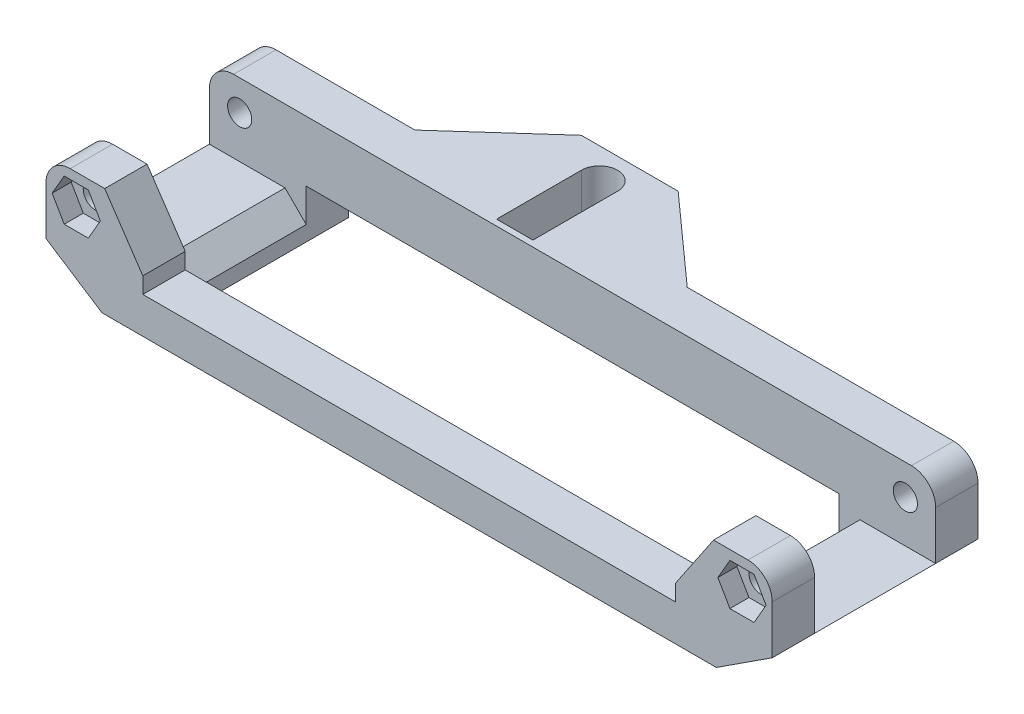
from build123d import *
from OCP.BRepFilletAPI import BRepFilletAPI_MakeChamfer

# Parameters (mm, degrees)
BOSS_EXTRUDE1_DEPTH                             = 10
FILLET4_R                                       = 4
SKETCH8_W                                       = 16
SKETCH8_H                                       = 7
BOSS_EXTRUDE3_DEPTH                             = 2
SKETCH9_W                                       = 16
SKETCH9_H                                       = 34
BOSS_EXTRUDE4_DEPTH                             = 6
BOSS_EXTRUDE5_DEPTH                             = 10
CUT_EXTRUDE3_DEPTH                              = 10
CHAMFER1_SIZE                                   = 6
CHAMFER1_SIZE_2                                 = 9.239189783
SKETCH13_W                                      = 7
SKETCH13_H                                      = 6
BOSS_EXTRUDE6_DEPTH                             = 88
CHAMFER2_SIZE                                   = 3.5
CSK_FOR_M4_FLAT_HEAD_MACHINE_SCREW1_D           = 4
CSK_FOR_M4_FLAT_HEAD_MACHINE_SCREW1_DEPTH       = 53.798278762
CSK_FOR_M4_FLAT_HEAD_MACHINE_SCREW1_CSINK_D     = 7.6
CSK_FOR_M4_FLAT_HEAD_MACHINE_SCREW1_CSINK_ANGLE = 90
CSK_FOR_M4_FLAT_HEAD_MACHINE_SCREW1_TIP         = 1.201721238
FILLET5_R                                       = 4
SKETCH17_W                                      = 6
SKETCH17_H                                      = 1
BOSS_EXTRUDE7_DEPTH                             = 10
CUT_EXTRUDE4_DEPTH                              = 3.15
CHAMFER3_SIZE                                   = 6.3
CHAMFER3_SIZE2                                  = 9.340134102


# Some blends are built 0.0001 mm under size
with BuildPart() as part:
    # Sketch1 → Boss-Extrude1 (new body)
    with BuildSketch(Plane(origin=(0, 0, 0), x_dir=(1, 0, 0), z_dir=(0, 1, 0))):
        Polygon((0, 17), (-60, 17), (-60, 10), (-43.720595315, 10), (-36.720595315, 10), (-28, 10), (-20, 10), (0, 10), align=None)
        Polygon((60, 17), (0, 17), (0, 10), (20, 10), (28, 10), (36.720595315, 10), (43.720595315, 10), (60, 10), align=None)
        Polygon((60, -10), (51, -10), (44, -10), (44, -17), (60, -17), align=None)
        Polygon((-44, -10), (-51, -10), (-60, -10), (-60, -17), (-44, -17), align=None)
    extrude(amount=BOSS_EXTRUDE1_DEPTH)

    # Fillet4
    fillet4_edges = [part.edges().sort_by_distance(p)[0] for p in [
        (60, 10, -13.5),
        (-60, 10, -13.5),
    ]]
    fillet(fillet4_edges, radius=FILLET4_R)

    # Sketch8 → Boss-Extrude3 (add)
    with BuildSketch(Plane.XZ):
        with Locations((-52, 13.5)):
            Rectangle(SKETCH8_W, SKETCH8_H)
        with Locations((52, 13.5)):
            Rectangle(SKETCH8_W, SKETCH8_H)
        with Locations((52, -13.5)):
            Rectangle(SKETCH8_W, SKETCH8_H)
        with Locations((-52, -13.5)):
            Rectangle(SKETCH8_W, SKETCH8_H)
    extrude(amount=BOSS_EXTRUDE3_DEPTH)

    # Sketch9 → Boss-Extrude4 (add)
    with BuildSketch(Plane.XZ.offset(2)):
        with Locations((-52, 0)):
            Rectangle(SKETCH9_W, SKETCH9_H)
        with Locations((52, 0)):
            Rectangle(SKETCH9_W, SKETCH9_H)
    extrude(amount=BOSS_EXTRUDE4_DEPTH)

    # Sketch10 → Boss-Extrude5 (add)
    with BuildSketch(Plane(origin=(0, 10, 0), x_dir=(1, 0, 0), z_dir=(0, 1, 0))):
        Polygon((-33.045425071, 17), (-18.545425071, 30), (-2.545425071, 30), (11.954574929, 17), align=None)
    extrude(amount=-BOSS_EXTRUDE5_DEPTH)

    # Sketch11 → Cut-Extrude3 (cut)
    with BuildSketch(Plane(origin=(0, 10, 0), x_dir=(1, 0, 0), z_dir=(0, 1, 0))):
        with BuildLine():
            Line((-7.545425071, 25), (-7.545425071, 11))
            ThreePointArc((-7.545425071, 11), (-10.545425071, 8), (-13.545425071, 11))
            Line((-13.545425071, 11), (-13.545425071, 25))
            ThreePointArc((-13.545425071, 25), (-10.545425071, 28), (-7.545425071, 25))
        make_face()
    extrude(amount=-CUT_EXTRUDE3_DEPTH, mode=Mode.SUBTRACT)

    # Chamfer1
    chamfer1_edges_1 = [part.edges().sort_by_distance(p)[0] for p in [
        (-60, -8, 0),
    ]]
    chamfer1_side_1 = [part.faces().sort_by_distance(p)[0] for p in [
        (-60, -7.88, 0),
    ]]
    chamfer1_edges_2 = [part.edges().sort_by_distance(p)[0] for p in [
        (60, -8, 0),
    ]]
    chamfer1_side_2 = [part.faces().sort_by_distance(p)[0] for p in [
        (60, -7.88, 0),
    ]]
    chamfer1 = BRepFilletAPI_MakeChamfer(part.part.solid().wrapped)
    for e in chamfer1_edges_1:
        chamfer1.Add(CHAMFER1_SIZE - 0.0001, CHAMFER1_SIZE_2 - 0.0001, e.wrapped, chamfer1_side_1[0].wrapped)
    for e in chamfer1_edges_2:
        chamfer1.Add(CHAMFER1_SIZE - 0.0001, CHAMFER1_SIZE_2 - 0.0001, e.wrapped, chamfer1_side_2[0].wrapped)
    add(Compound.cast(chamfer1.Shape()), mode=Mode.REPLACE)  # a hair under: the kernel refuses the full size

    # Sketch13 → Boss-Extrude6 (add)
    with BuildSketch(Plane.ZY.offset(-44)):
        with Locations((13.5, -5)):
            Rectangle(SKETCH13_W, SKETCH13_H)
    extrude(amount=BOSS_EXTRUDE6_DEPTH)

    # Chamfer2
    # the kernel refuses this chamfer: 3.5 mm, written as the material it takes off along each edge
    with BuildSketch(Plane(origin=(-44, -2, -10), x_dir=(-0.9996219169112968, 0.027495876610586372, 0), z_dir=(0, 0, 1)), Plane(origin=(44, -2, 10), x_dir=(0.9996219169112968, 0.027495876610586188, 0), z_dir=(0, 0, -1))) as chamfer2_piece_1:
        Polygon((CHAMFER2_SIZE * 0.999621916911, CHAMFER2_SIZE * 0.0274958766106), (-CHAMFER2_SIZE * 0.0274958766106, CHAMFER2_SIZE * 0.999621916911), (0, 0), align=None)
    extrude(amount=20, mode=Mode.SUBTRACT)

    # CSK for M4 Flat Head Machine Screw1
    with Locations(Plane(origin=(0, 0, -17), x_dir=(-1, 0, 0), z_dir=(0, 0, -1))):
        with Locations((-55, 5), (55, 5)):
            CounterSinkHole(CSK_FOR_M4_FLAT_HEAD_MACHINE_SCREW1_D / 2, CSK_FOR_M4_FLAT_HEAD_MACHINE_SCREW1_CSINK_D / 2, depth=CSK_FOR_M4_FLAT_HEAD_MACHINE_SCREW1_DEPTH, counter_sink_angle=CSK_FOR_M4_FLAT_HEAD_MACHINE_SCREW1_CSINK_ANGLE)
            with Locations((0, 0, -(CSK_FOR_M4_FLAT_HEAD_MACHINE_SCREW1_DEPTH + CSK_FOR_M4_FLAT_HEAD_MACHINE_SCREW1_TIP / 2))):  # 118° drill point
                Cone(0, CSK_FOR_M4_FLAT_HEAD_MACHINE_SCREW1_D / 2, CSK_FOR_M4_FLAT_HEAD_MACHINE_SCREW1_TIP, mode=Mode.SUBTRACT)

    # Fillet5
    fillet5_edges = [part.edges().sort_by_distance(p)[0] for p in [
        (-60, 10, 13.5),
        (60, 10, 13.5),
    ]]
    fillet(fillet5_edges, radius=FILLET5_R)

    # Sketch17 → Boss-Extrude7 (add)
    with BuildSketch(Plane(origin=(0, 10, 0), x_dir=(1, 0, 0), z_dir=(0, 1, 0))):
        with Locations((-10.545425071, 10.5)):
            Rectangle(SKETCH17_W, SKETCH17_H)
    extrude(amount=-BOSS_EXTRUDE7_DEPTH)

    # Sketch18 → Cut-Extrude4 (cut)
    with BuildSketch(Plane.XY.offset(17)):
        Polygon((51.016283143, 5), (53.008141571, 1.55), (56.991858429, 1.55), (58.983716857, 5), (56.991858429, 8.45), (53.008141571, 8.45), align=None)
        Polygon((-51.016283143, 5), (-53.008141571, 8.45), (-56.991858429, 8.45), (-58.983716857, 5), (-56.991858429, 1.55), (-53.008141571, 1.55), align=None)
    extrude(amount=-CUT_EXTRUDE4_DEPTH, mode=Mode.SUBTRACT)

    # Chamfer3: one chamfer whose edges measure the first distance from different faces: ONE call of the kernel's chamfer builder (chamfer() names one face for all edges)
    chamfer3_edges_1 = [part.edges().sort_by_distance(p)[0] for p in [
        (-44, 10, 13.5),
    ]]
    chamfer3_side_1 = [part.faces().sort_by_distance(p)[0] for p in [
        (-50, 10, 13.5),
    ]]
    chamfer3_edges_2 = [part.edges().sort_by_distance(p)[0] for p in [
        (44, 10, 13.5),
    ]]
    chamfer3_side_2 = [part.faces().sort_by_distance(p)[0] for p in [
        (50, 10, 13.5),
    ]]
    chamfer3 = BRepFilletAPI_MakeChamfer(part.part.solid().wrapped)
    for e in chamfer3_edges_1:
        chamfer3.Add(CHAMFER3_SIZE, CHAMFER3_SIZE2, e.wrapped, chamfer3_side_1[0].wrapped)  # the first distance lies on this face
    for e in chamfer3_edges_2:
        chamfer3.Add(CHAMFER3_SIZE, CHAMFER3_SIZE2, e.wrapped, chamfer3_side_2[0].wrapped)  # the first distance lies on this face
    add(Compound.cast(chamfer3.Shape()), mode=Mode.REPLACE)


solid = part.part
